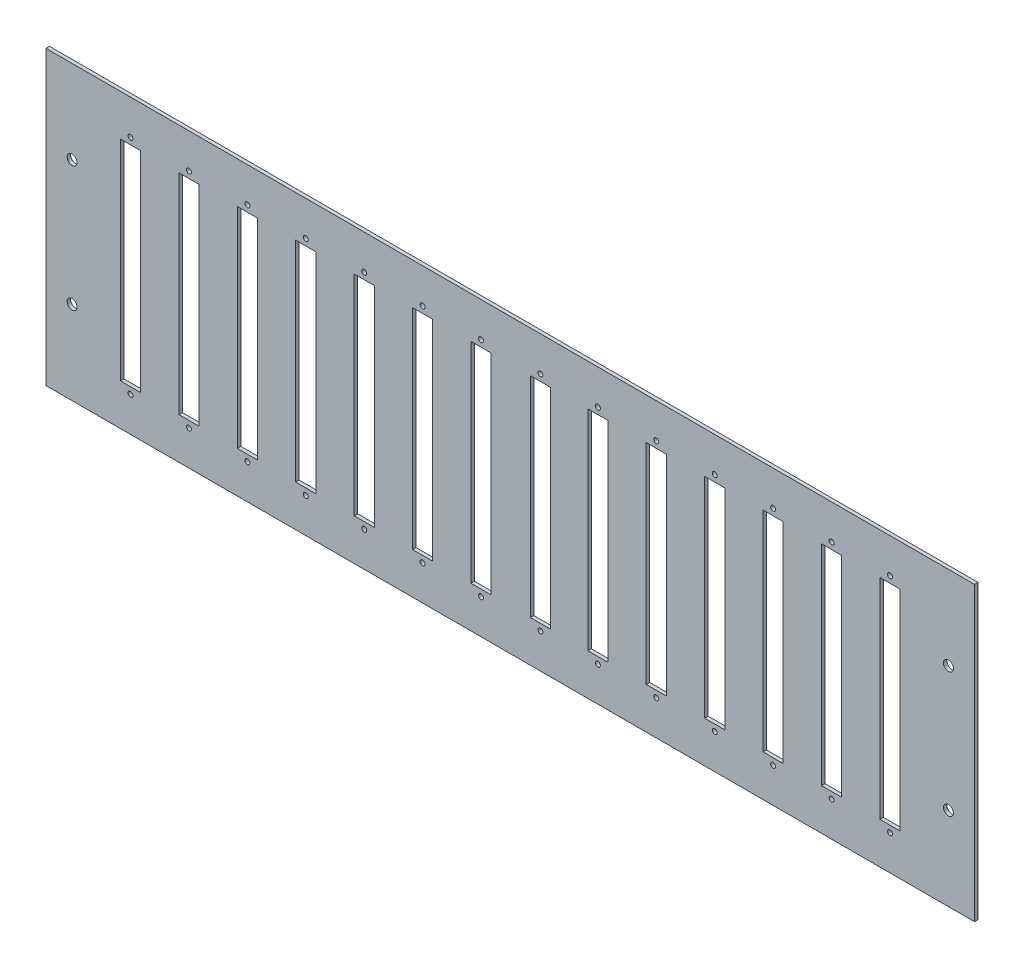
from build123d import *

# Parameters (mm, degrees)
SKETCH1_W           = 423.8752
SKETCH1_H           = 133.35
SKETCH1_R           = 1.1303
SKETCH1_R_2         = 2.2606
SKETCH1_W_2         = 9.2075
SKETCH1_H_2         = 95.631
BOSS_EXTRUDE1_DEPTH = 1.5875


with BuildPart() as part:
    # Sketch1 → Boss-Extrude1 (new body)
    with BuildSketch(Plane.XY):
        with Locations((211.9376, 66.675)):
            Rectangle(SKETCH1_W, SKETCH1_H)
        with Locations((38.5826, 15.875)):
            Circle(SKETCH1_R, mode=Mode.SUBTRACT)
        with Locations((65.2526, 15.875)):
            Circle(SKETCH1_R, mode=Mode.SUBTRACT)
        with Locations((91.9226, 15.875)):
            Circle(SKETCH1_R, mode=Mode.SUBTRACT)
        with Locations((118.5926, 15.875)):
            Circle(SKETCH1_R, mode=Mode.SUBTRACT)
        with Locations((145.2626, 15.875)):
            Circle(SKETCH1_R, mode=Mode.SUBTRACT)
        with Locations((171.9326, 15.875)):
            Circle(SKETCH1_R, mode=Mode.SUBTRACT)
        with Locations((198.6026, 15.875)):
            Circle(SKETCH1_R, mode=Mode.SUBTRACT)
        with Locations((11.9126, 38.1)):
            Circle(SKETCH1_R_2, mode=Mode.SUBTRACT)
        with Locations((225.704188438, 15.875)):
            Circle(SKETCH1_R, mode=Mode.SUBTRACT)
        with Locations((251.9426, 15.875)):
            Circle(SKETCH1_R, mode=Mode.SUBTRACT)
        with Locations((278.6126, 15.875)):
            Circle(SKETCH1_R, mode=Mode.SUBTRACT)
        with Locations((305.2826, 15.875)):
            Circle(SKETCH1_R, mode=Mode.SUBTRACT)
        with Locations((331.9526, 15.875)):
            Circle(SKETCH1_R, mode=Mode.SUBTRACT)
        with Locations((358.6226, 15.875)):
            Circle(SKETCH1_R, mode=Mode.SUBTRACT)
        with Locations((385.2926, 15.875)):
            Circle(SKETCH1_R, mode=Mode.SUBTRACT)
        with Locations((251.9426, 66.675)):
            Rectangle(SKETCH1_W_2, SKETCH1_H_2, mode=Mode.SUBTRACT)
        with Locations((278.6126, 66.675)):
            Rectangle(SKETCH1_W_2, SKETCH1_H_2, mode=Mode.SUBTRACT)
        with Locations((305.2826, 66.675)):
            Rectangle(SKETCH1_W_2, SKETCH1_H_2, mode=Mode.SUBTRACT)
        with Locations((411.9626, 38.1)):
            Circle(SKETCH1_R_2, mode=Mode.SUBTRACT)
        with Locations((358.6226, 66.675)):
            Rectangle(SKETCH1_W_2, SKETCH1_H_2, mode=Mode.SUBTRACT)
        with Locations((385.2926, 66.675)):
            Rectangle(SKETCH1_W_2, SKETCH1_H_2, mode=Mode.SUBTRACT)
        with Locations((38.5826, 66.675)):
            Rectangle(SKETCH1_W_2, SKETCH1_H_2, mode=Mode.SUBTRACT)
        with Locations((65.2526, 66.675)):
            Rectangle(SKETCH1_W_2, SKETCH1_H_2, mode=Mode.SUBTRACT)
        with Locations((91.9226, 66.675)):
            Rectangle(SKETCH1_W_2, SKETCH1_H_2, mode=Mode.SUBTRACT)
        with Locations((11.9126, 95.25)):
            Circle(SKETCH1_R_2, mode=Mode.SUBTRACT)
        with Locations((118.5926, 66.675)):
            Rectangle(SKETCH1_W_2, SKETCH1_H_2, mode=Mode.SUBTRACT)
        with Locations((145.2626, 66.675)):
            Rectangle(SKETCH1_W_2, SKETCH1_H_2, mode=Mode.SUBTRACT)
        with Locations((171.9326, 66.675)):
            Rectangle(SKETCH1_W_2, SKETCH1_H_2, mode=Mode.SUBTRACT)
        with Locations((198.6026, 66.675)):
            Rectangle(SKETCH1_W_2, SKETCH1_H_2, mode=Mode.SUBTRACT)
        with Locations((38.5826, 117.475)):
            Circle(SKETCH1_R, mode=Mode.SUBTRACT)
        with Locations((65.2526, 117.475)):
            Circle(SKETCH1_R, mode=Mode.SUBTRACT)
        with Locations((91.9226, 117.475)):
            Circle(SKETCH1_R, mode=Mode.SUBTRACT)
        with Locations((118.5926, 117.475)):
            Circle(SKETCH1_R, mode=Mode.SUBTRACT)
        with Locations((145.2626, 117.475)):
            Circle(SKETCH1_R, mode=Mode.SUBTRACT)
        with Locations((171.9326, 117.475)):
            Circle(SKETCH1_R, mode=Mode.SUBTRACT)
        with Locations((198.6026, 117.475)):
            Circle(SKETCH1_R, mode=Mode.SUBTRACT)
        with Locations((225.704188438, 66.675)):
            Rectangle(SKETCH1_W_2, SKETCH1_H_2, mode=Mode.SUBTRACT)
        with Locations((331.9526, 66.675)):
            Rectangle(SKETCH1_W_2, SKETCH1_H_2, mode=Mode.SUBTRACT)
        with Locations((411.9626, 95.25)):
            Circle(SKETCH1_R_2, mode=Mode.SUBTRACT)
        with Locations((225.704188438, 117.475)):
            Circle(SKETCH1_R, mode=Mode.SUBTRACT)
        with Locations((251.9426, 117.475)):
            Circle(SKETCH1_R, mode=Mode.SUBTRACT)
        with Locations((278.6126, 117.475)):
            Circle(SKETCH1_R, mode=Mode.SUBTRACT)
        with Locations((305.2826, 117.475)):
            Circle(SKETCH1_R, mode=Mode.SUBTRACT)
        with Locations((331.9526, 117.475)):
            Circle(SKETCH1_R, mode=Mode.SUBTRACT)
        with Locations((358.6226, 117.475)):
            Circle(SKETCH1_R, mode=Mode.SUBTRACT)
        with Locations((385.2926, 117.475)):
            Circle(SKETCH1_R, mode=Mode.SUBTRACT)
    extrude(amount=BOSS_EXTRUDE1_DEPTH)


solid = part.part
